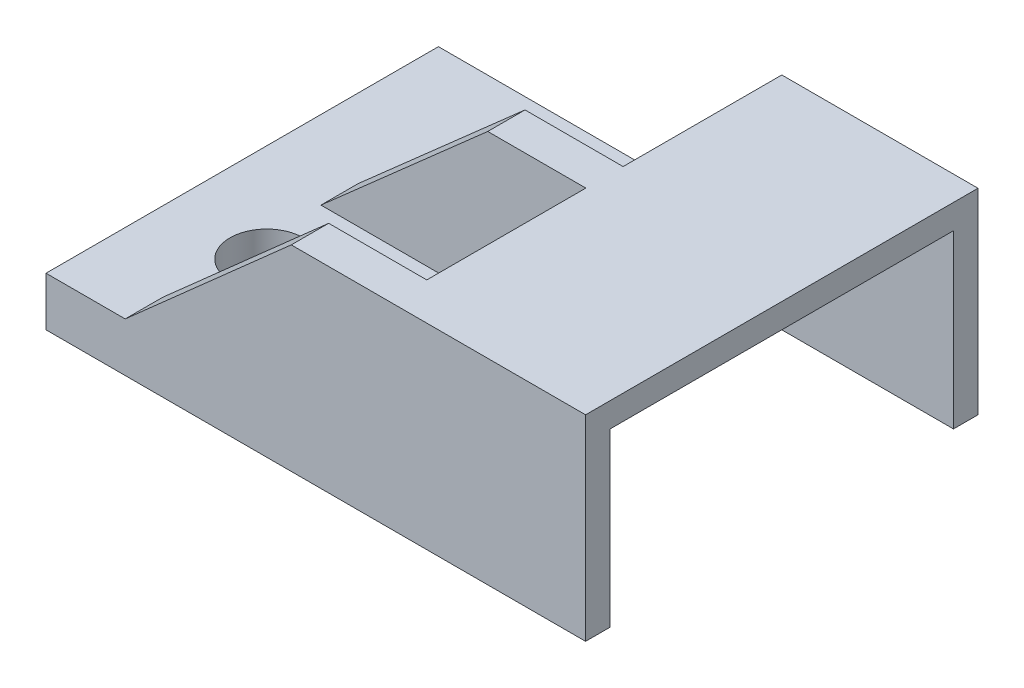
from build123d import *

# Parameters (mm, degrees)
SKETCH1_W            = 139.7
SKETCH1_H            = 101.6
BOSS_EXTRUDE1_DEPTH  = 12.7
SKETCH2_W            = 44.45
SKETCH2_H            = 6.35
BOSS_EXTRUDE2_DEPTH  = 31.75
SKETCH3_W            = 44.45
SKETCH3_H            = 6.35
BOSS_EXTRUDE3_DEPTH  = 31.75
SKETCH4_W            = 6.35
SKETCH4_H            = 101.6
BOSS_EXTRUDE4_DEPTH  = 31.75
SKETCH5_W            = 50.8
SKETCH5_H            = 101.6
BOSS_EXTRUDE5_DEPTH  = 6.35
SKETCH7_W            = 44.45
SKETCH7_H            = 88.9
BOSS_EXTRUDE7_DEPTH  = 12.7
SKETCH9_W            = 44.45
SKETCH9_H            = 88.9
CUT_EXTRUDE1_DEPTH   = 12.7
SKETCH10_W           = 25.218134922
SKETCH10_H           = 9.68567434
BOSS_EXTRUDE8_DEPTH  = 38.1
SKETCH11_W           = 25.4
SKETCH11_H           = 9.652
BOSS_EXTRUDE9_DEPTH  = 38.1
SKETCH12_R           = 9.525
CUT_EXTRUDE2_DEPTH   = 38.1
SKETCH13_W           = 43.179728204
SKETCH13_H           = 9.652
BOSS_EXTRUDE10_DEPTH = 38.1
SKETCH14_W           = 43.18
SKETCH14_H           = 9.68567434
BOSS_EXTRUDE11_DEPTH = 38.1
CUT_EXTRUDE8_START   = -9.68567434
CUT_EXTRUDE8_DEPTH   = 9.68567434
CUT_EXTRUDE10_DEPTH  = 38.1


# Read off the part's stored shape, not the designer's step: Cut-Extrude8
with BuildPart() as part:
    # Sketch1 → Boss-Extrude1 (new body)
    with BuildSketch(Plane(origin=(0, 0, 0), x_dir=(1, 0, 0), z_dir=(0, 1, 0))):
        with Locations((69.85, 50.8)):
            Rectangle(SKETCH1_W, SKETCH1_H)
    extrude(amount=BOSS_EXTRUDE1_DEPTH)

    # Sketch2 → Boss-Extrude2 (add)
    with BuildSketch(Plane(origin=(0, 12.7, 0), x_dir=(1, 0, 0), z_dir=(0, 1, 0))):
        with Locations((117.475, 3.175)):
            Rectangle(SKETCH2_W, SKETCH2_H)
    extrude(amount=BOSS_EXTRUDE2_DEPTH)

    # Sketch3 → Boss-Extrude3 (add)
    with BuildSketch(Plane(origin=(0, 12.7, 0), x_dir=(1, 0, 0), z_dir=(0, 1, 0))):
        with Locations((117.475, 98.425)):
            Rectangle(SKETCH3_W, SKETCH3_H)
    extrude(amount=BOSS_EXTRUDE3_DEPTH)

    # Sketch4 → Boss-Extrude4 (add)
    with BuildSketch(Plane(origin=(0, 12.7, 0), x_dir=(1, 0, 0), z_dir=(0, 1, 0))):
        with Locations((92.075, 50.8)):
            Rectangle(SKETCH4_W, SKETCH4_H)
    extrude(amount=BOSS_EXTRUDE4_DEPTH)

    # Sketch5 → Boss-Extrude5 (add)
    with BuildSketch(Plane(origin=(0, 44.45, 0), x_dir=(1, 0, 0), z_dir=(0, 1, 0))):
        with Locations((114.3, 50.8)):
            Rectangle(SKETCH5_W, SKETCH5_H)
    extrude(amount=BOSS_EXTRUDE5_DEPTH)

    # Sketch7 → Boss-Extrude7 (add)
    with BuildSketch(Plane(origin=(0, 12.7, 0), x_dir=(1, 0, 0), z_dir=(0, 1, 0))):
        with Locations((117.475, 50.8)):
            Rectangle(SKETCH7_W, SKETCH7_H)
    extrude(amount=-BOSS_EXTRUDE7_DEPTH)

    # Sketch9 → Cut-Extrude1 (cut)
    with BuildSketch(Plane(origin=(0, 12.7, 0), x_dir=(1, 0, 0), z_dir=(0, 1, 0))):
        with Locations((117.475, 50.8)):
            Rectangle(SKETCH9_W, SKETCH9_H)
    extrude(amount=-CUT_EXTRUDE1_DEPTH, mode=Mode.SUBTRACT)

    # Sketch10 → Boss-Extrude8 (add)
    with BuildSketch(Plane(origin=(0, 12.7, 0), x_dir=(1, 0, 0), z_dir=(0, 1, 0))):
        with Locations((76.290932539, 4.84283717)):
            Rectangle(SKETCH10_W, SKETCH10_H)
    extrude(amount=BOSS_EXTRUDE8_DEPTH)

    # Sketch11 → Boss-Extrude9 (add)
    with BuildSketch(Plane(origin=(0, 12.7, 0), x_dir=(1, 0, 0), z_dir=(0, 1, 0))):
        with Locations((76.2, 55.693142425)):
            Rectangle(SKETCH11_W, SKETCH11_H)
    extrude(amount=BOSS_EXTRUDE9_DEPTH)

    # Sketch12 → Cut-Extrude2 (cut)
    with BuildSketch(Plane(origin=(0, 12.7, 0), x_dir=(1, 0, 0), z_dir=(0, 1, 0))):
        with Locations(Location((25.4, 31.75, 0), (0, 0, 270))):
            Circle(SKETCH12_R)
    extrude(amount=-CUT_EXTRUDE2_DEPTH, mode=Mode.SUBTRACT)

    # Sketch13 → Boss-Extrude10 (add)
    with BuildSketch(Plane(origin=(0, 12.7, 0), x_dir=(1, 0, 0), z_dir=(0, 1, 0))):
        with Locations((41.910135898, 55.693142425)):
            Rectangle(SKETCH13_W, SKETCH13_H)
    extrude(amount=BOSS_EXTRUDE10_DEPTH)

    # Sketch14 → Boss-Extrude11 (add)
    with BuildSketch(Plane(origin=(0, 12.7, 0), x_dir=(1, 0, 0), z_dir=(0, 1, 0))):
        with Locations((42.091865078, 4.84283717)):
            Rectangle(SKETCH14_W, SKETCH14_H)
    extrude(amount=BOSS_EXTRUDE11_DEPTH)

    # Cut-Extrude8 outline → Cut-Extrude8 (cut)
    with BuildSketch(Plane.XY.offset(CUT_EXTRUDE8_START)):
        Polygon((20.501865078, 50.8), (20.501865078, 12.7), (63.500271796, 50.8), align=None)
    extrude(amount=CUT_EXTRUDE8_DEPTH, mode=Mode.SUBTRACT)

    # Sketch16 → Cut-Extrude10 (cut)
    with BuildSketch(Plane.XY.offset(-50.867142425)):
        Polygon((20.320271796, 12.7), (20.320271796, 50.8), (63.500271796, 50.8), align=None)
    extrude(amount=-CUT_EXTRUDE10_DEPTH, mode=Mode.SUBTRACT)


solid = part.part
